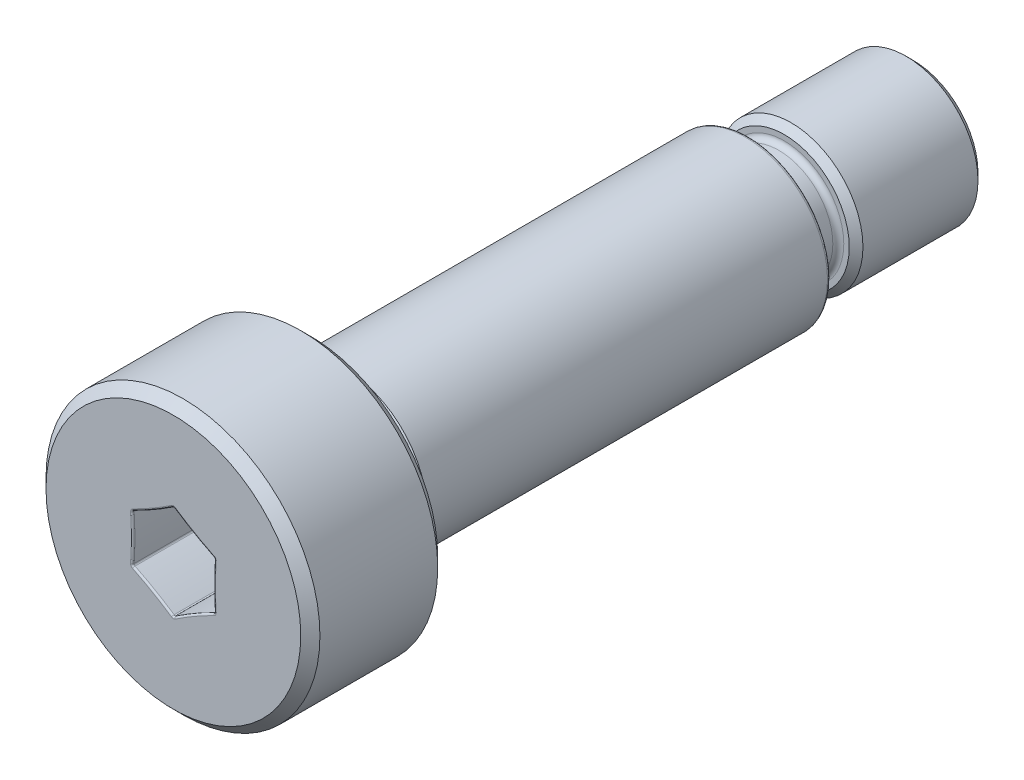
from build123d import *

# Parameters (mm, degrees)
SKETCH4_W          = 0.9921875
SKETCH4_H          = 0.3571875
SKETCH4_W_2        = 1.031875
SKETCH4_H_2        = 0.515555748
CHAMFER1_SIZE      = 0.3571875
FILLET1_R          = 0.17859375
FILLET2_R          = 0.15875
CHAMFER2_SIZE      = 0.1984375
FILLET3_R          = 0.09525
CHAMFER3_SIZE      = 0.2778125
CUT_EXTRUDE1_DEPTH = 2.0828
FILLET4_R          = 0.0508


with BuildPart() as part:
    # Sketch3 → Revolve1 (revolve)
    with BuildSketch(Plane(origin=(0, 0, 0), x_dir=(0, 0, -1), z_dir=(1, 0, 0)), mode=Mode.PRIVATE) as revolve1_sk:
        Polygon((-3.96875, 3.96875), (0, 3.96875), (0, 2.38125), (12.7, 2.38125), (12.7, 2.0828), (17.4625, 2.0828), (17.4625, 0), (-3.96875, 0), align=None)
    revolve(revolve1_sk.sketch.rotate(Axis((0, 0, 3.96875), (0, 0, -1)), 90), axis=Axis((0, 0, 3.96875), (0, 0, -1)))

    # Sketch4 → Cut-Revolve1 (revolve, cut)
    with BuildSketch(Plane(origin=(0, 0, 0), x_dir=(0, 0, -1), z_dir=(1, 0, 0)), mode=Mode.PRIVATE) as cut_revolve1_sk:
        with Locations((0.49609375, 2.20265625)):
            Rectangle(SKETCH4_W, SKETCH4_H)
        with Locations((13.2159375, 1.825022126)):
            Rectangle(SKETCH4_W_2, SKETCH4_H_2)
    revolve(cut_revolve1_sk.sketch.rotate(Axis((0, 0, 3.96875), (0, 0, -1)), 90), axis=Axis((0, 0, 3.96875), (0, 0, -1)), mode=Mode.SUBTRACT)

    # Chamfer1
    chamfer1_edges = [part.edges().sort_by_distance(p)[0] for p in [
        (-2.0240625, 0, -0.9921875),
    ]]
    chamfer(chamfer1_edges, length=CHAMFER1_SIZE - 0.0001)  # a hair under: the kernel refuses the full size

    # Fillet1
    fillet1_edges = [part.edges().sort_by_distance(p)[0] for p in [
        (-2.0240625, 0, 0),
    ]]
    fillet(fillet1_edges, radius=FILLET1_R)

    # Fillet2
    fillet2_edges = [part.edges().sort_by_distance(p)[0] for p in [
        (-1.567244252, 0, -12.7),
        (-1.567244252, 0, -13.731875),
    ]]
    fillet(fillet2_edges, radius=FILLET2_R)

    # Chamfer2
    chamfer2_edges = [part.edges().sort_by_distance(p)[0] for p in [
        (-2.0828, 0, -13.731875),
        (-2.0828, 0, -17.4625),
    ]]
    chamfer(chamfer2_edges, length=CHAMFER2_SIZE)

    # Fillet3
    fillet3_edges = [part.edges().sort_by_distance(p)[0] for p in [
        (-2.38125, 0, -12.7),
    ]]
    fillet(fillet3_edges, radius=FILLET3_R)

    # Chamfer3
    chamfer3_edges = [part.edges().sort_by_distance(p)[0] for p in [
        (-3.96875, 0, 0),
        (-3.96875, 0, 3.96875),
    ]]
    chamfer(chamfer3_edges, length=CHAMFER3_SIZE)

    # Sketch5 → Cut-Extrude1 (cut)
    with BuildSketch(Plane.XY.offset(3.96875)):
        with BuildLine():
            ThreePointArc((1.190625, 0.687407664), (0.58340625, 1.010489266), (0, 1.374815329))
            ThreePointArc((0, 1.374815329), (-0.58340625, 1.010489266), (-1.190625, 0.687407664))
            ThreePointArc((-1.190625, 0.687407664), (-1.1668125, 0), (-1.190625, -0.687407664))
            ThreePointArc((-1.190625, -0.687407664), (-0.58340625, -1.010489266), (0, -1.374815329))
            ThreePointArc((0, -1.374815329), (0.58340625, -1.010489266), (1.190625, -0.687407664))
            ThreePointArc((1.190625, -0.687407664), (1.1668125, 0), (1.190625, 0.687407664))
        make_face()
    extrude(amount=-CUT_EXTRUDE1_DEPTH, mode=Mode.SUBTRACT)

    # Fillet4
    fillet4_edges = [part.edges().sort_by_distance(p)[0] for p in [
        (1.1668125, 0, 1.88595),
        (1.190625, 0.687407664, 2.92735),
        (0.58340625, -1.010489266, 1.88595),
        (1.190625, -0.687407664, 2.92735),
        (-0.58340625, -1.010489266, 1.88595),
        (0, -1.374815329, 2.92735),
        (-1.1668125, 0, 1.88595),
        (-1.190625, -0.687407664, 2.92735),
        (-0.58340625, 1.010489266, 1.88595),
        (-1.190625, 0.687407664, 2.92735),
        (0.58340625, 1.010489266, 1.88595),
        (0, 1.374815329, 2.92735),
        (1.1668125, 0, 3.96875),
        (0.58340625, 1.010489266, 3.96875),
        (-0.58340625, 1.010489266, 3.96875),
        (-1.1668125, 0, 3.96875),
        (-0.58340625, -1.010489266, 3.96875),
        (0.58340625, -1.010489266, 3.96875),
    ]]
    fillet(fillet4_edges, radius=FILLET4_R)


solid = part.part
